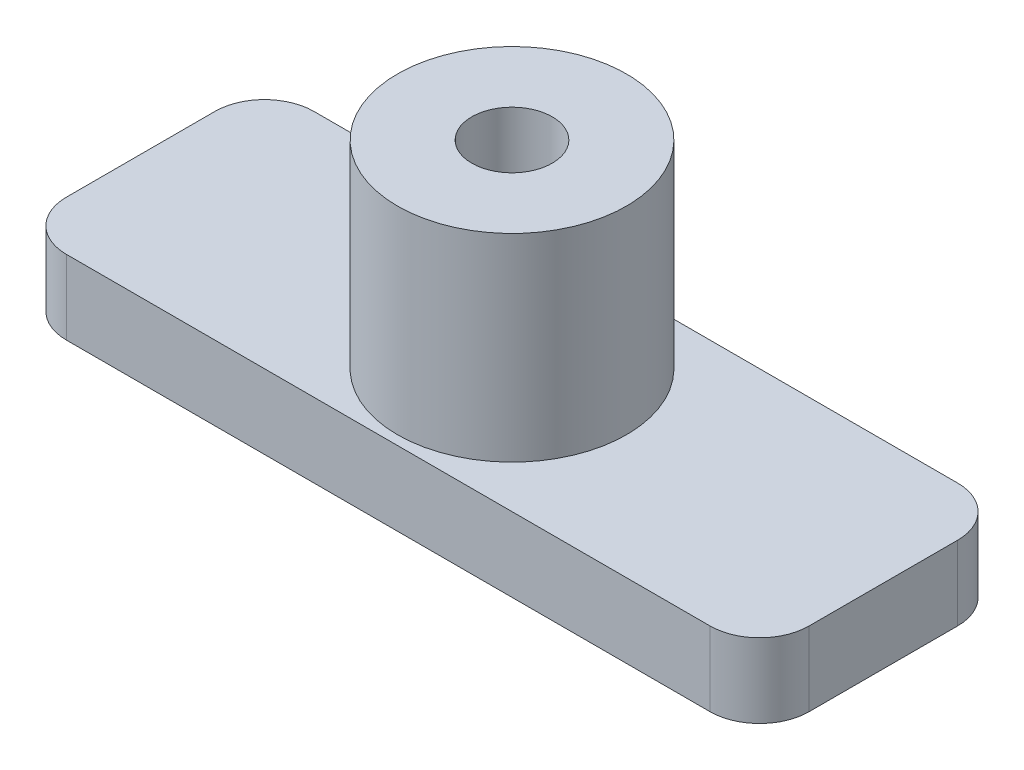
from build123d import *

# Parameters (mm, degrees)
SKETCH1_W           = 30
SKETCH1_H           = 10
BOSS_EXTRUDE1_DEPTH = 3
SKETCH2_R           = 4.625
SKETCH2_R_2         = 1.625
BOSS_EXTRUDE2_DEPTH = 8
FILLET1_R           = 2


with BuildPart() as part:
    # Sketch1 → Boss-Extrude1 (new body)
    with BuildSketch(Plane(origin=(0, 0, 0), x_dir=(1, 0, 0), z_dir=(0, 1, 0))):
        Rectangle(SKETCH1_W, SKETCH1_H)
    extrude(amount=BOSS_EXTRUDE1_DEPTH)

    # Sketch2 → Boss-Extrude2 (add)
    with BuildSketch(Plane(origin=(0, 3, 0), x_dir=(1, 0, 0), z_dir=(0, 1, 0))):
        Circle(SKETCH2_R)
        Circle(SKETCH2_R_2, mode=Mode.SUBTRACT)
    extrude(amount=BOSS_EXTRUDE2_DEPTH)

    # Fillet1
    fillet1_edges = [part.edges().sort_by_distance(p)[0] for p in [
        (15, 1.5, -5),
        (15, 1.5, 5),
        (-15, 1.5, -5),
        (-15, 1.5, 5),
    ]]
    fillet(fillet1_edges, radius=FILLET1_R)


solid = part.part
